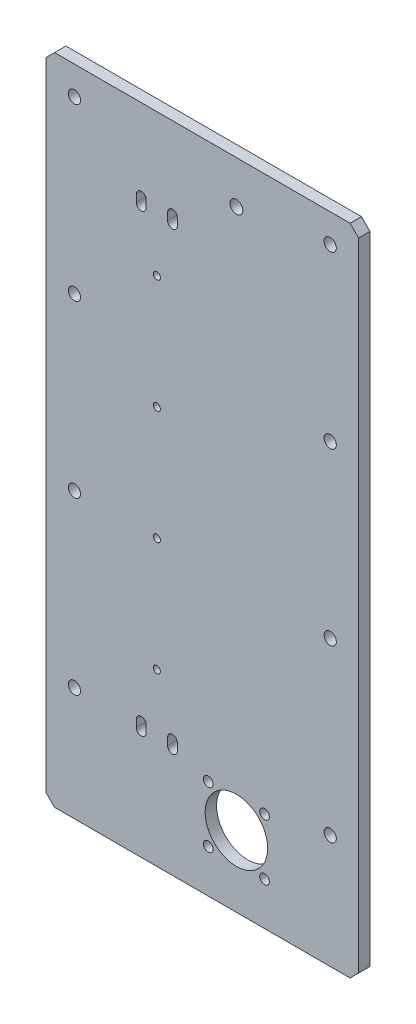
from build123d import *

# Parameters (mm, degrees)
SKIZZE1_W                       = 110
SKIZZE1_H                       = 230
AUFSATZ_LINEAR_AUSTRAGEN1_DEPTH = 4
M3_GEWINDEBOHRUNG1_D            = 2.5
DURCHGANGSLOCH_F_R_M41_D        = 4.3
DURCHGANGSLOCH_F_R_M33_DEPTH    = 4
DURCHGANGSLOCH_F_R_M32_D        = 3.4
SKIZZE10_R                      = 11
SCHNITT_LINEAR_AUSTRAGEN1_DEPTH = 128.538229563
DURCHGANGSLOCH_F_R_M42_D        = 4.5
FASE1_SIZE                      = 3


# Read off the part's stored shape, not the designer's step: Durchgangsloch für M33
with BuildPart() as part:
    # Skizze1 → Aufsatz-Linear austragen1 (new body)
    with BuildSketch(Plane.XY):
        Rectangle(SKIZZE1_W, SKIZZE1_H)
    extrude(amount=AUFSATZ_LINEAR_AUSTRAGEN1_DEPTH)

    # M3 Gewindebohrung1 (through all)
    with Locations(Plane.XY.offset(4)):
        with Locations((-16, 65), (-16, 25), (-16, -15), (-16, -55)):
            Hole(M3_GEWINDEBOHRUNG1_D / 2)

    # Durchgangsloch für M41 (through all)
    with Locations(Plane.XY.offset(4)):
        with Locations((-45, 105), (45, 105), (-45, 45), (-45, -15), (45, 45), (45, -15), (45, -75), (-45, -75)):
            Hole(DURCHGANGSLOCH_F_R_M41_D / 2)

    # Durchgangsloch für M33 outline → Durchgangsloch für M33 (cut)
    with BuildSketch(Plane.XY):
        with BuildLine():
            Line((-8.8, 83.7), (-8.8, 86.3))
            ThreePointArc((-8.8, 86.3), (-10.5, 88), (-12.2, 86.3))
            Line((-12.2, 86.3), (-12.2, 83.7))
            ThreePointArc((-12.2, 83.7), (-10.5, 82), (-8.8, 83.7))
        make_face()
        with BuildLine():
            ThreePointArc((-8.8, -73.7), (-10.5, -72), (-12.2, -73.7))
            Line((-12.2, -73.7), (-12.2, -76.3))
            ThreePointArc((-12.2, -76.3), (-10.5, -78), (-8.8, -76.3))
            Line((-8.8, -76.3), (-8.8, -73.7))
        make_face()
        with BuildLine():
            Line((-19.8, 83.7), (-19.8, 86.3))
            ThreePointArc((-19.8, 86.3), (-21.5, 88), (-23.2, 86.3))
            Line((-23.2, 86.3), (-23.2, 83.7))
            ThreePointArc((-23.2, 83.7), (-21.5, 82), (-19.8, 83.7))
        make_face()
        with BuildLine():
            ThreePointArc((-19.8, -73.7), (-21.5, -72), (-23.2, -73.7))
            Line((-23.2, -73.7), (-23.2, -76.3))
            ThreePointArc((-23.2, -76.3), (-21.5, -78), (-19.8, -76.3))
            Line((-19.8, -76.3), (-19.8, -73.7))
        make_face()
    extrude(amount=DURCHGANGSLOCH_F_R_M33_DEPTH, mode=Mode.SUBTRACT)

    # Durchgangsloch für M32 (through all)
    with Locations(Plane.XY.offset(4)):
        with Locations((21.899494937, -80.100505063), (2.100505063, -80.100505063), (21.899494937, -99.899494937), (2.100505063, -99.899494937)):
            Hole(DURCHGANGSLOCH_F_R_M32_D / 2)

    # Skizze10 → Schnitt-Linear austragen1 (cut, through all)
    with BuildSketch(Plane.XY.offset(4)):
        with Locations((12, -90)):
            Circle(SKIZZE10_R)
    extrude(amount=-SCHNITT_LINEAR_AUSTRAGEN1_DEPTH, mode=Mode.SUBTRACT)

    # Durchgangsloch für M42 (through all)
    with Locations(Plane.XY.offset(4)):
        with Locations((12, 100)):
            Hole(DURCHGANGSLOCH_F_R_M42_D / 2)

    # Fase1
    fase1_edges = [part.edges().sort_by_distance(p)[0] for p in [
        (-55, 115, 2),
        (55, 115, 2),
        (55, -115, 2),
        (-55, -115, 2),
    ]]
    chamfer(fase1_edges, length=FASE1_SIZE)


solid = part.part
